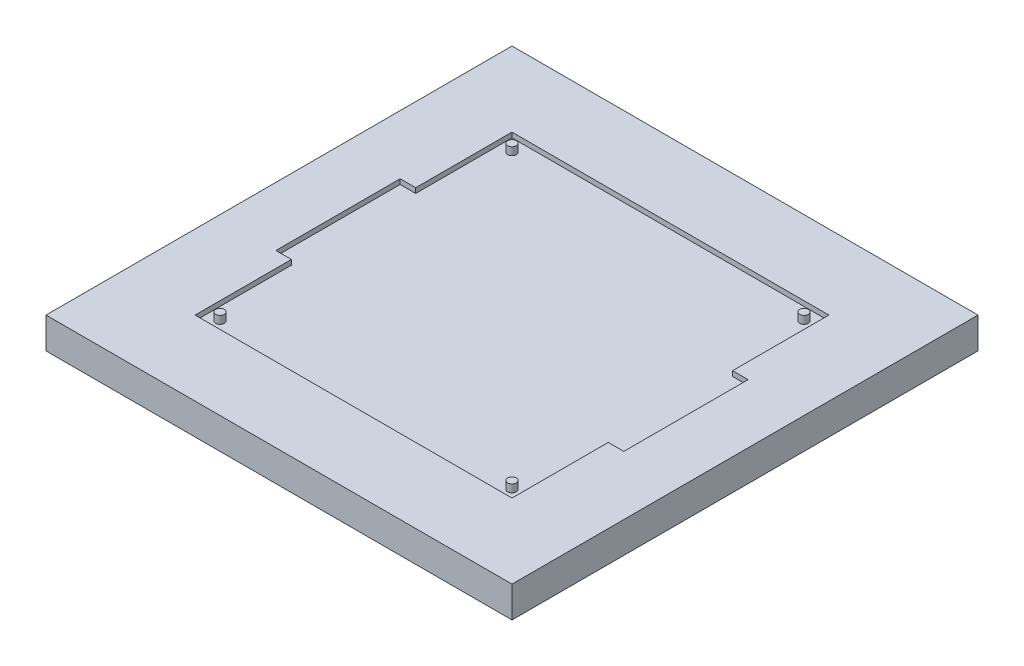
from build123d import *

# Parameters (mm, degrees)
SKETCH1_W           = 150
SKETCH1_H           = 150
BOSS_EXTRUDE1_DEPTH = 10
SKETCH3_W           = 102
SKETCH3_H           = 102
CUT_EXTRUDE1_DEPTH  = 1.6
SKETCH4_R           = 1.4
BOSS_EXTRUDE3_DEPTH = 2.5
SKETCH11_W          = 5
SKETCH11_H          = 40
CUT_EXTRUDE3_DEPTH  = 1.6


with BuildPart() as part:
    # Sketch1 → Boss-Extrude1 (new body)
    with BuildSketch(Plane(origin=(0, 0, 0), x_dir=(1, 0, 0), z_dir=(0, 1, 0))):
        with Locations((75, 75)):
            Rectangle(SKETCH1_W, SKETCH1_H)
    extrude(amount=BOSS_EXTRUDE1_DEPTH)

    # Sketch3 → Cut-Extrude1 (cut)
    with BuildSketch(Plane(origin=(0, 10, 0), x_dir=(1, 0, 0), z_dir=(0, 1, 0))):
        with Locations((75, 75)):
            Rectangle(SKETCH3_W, SKETCH3_H)
    extrude(amount=-CUT_EXTRUDE1_DEPTH, mode=Mode.SUBTRACT)

    # Sketch4 → Boss-Extrude3 (add)
    with BuildSketch(Plane(origin=(0, 8.4, 0), x_dir=(1, 0, 0), z_dir=(0, 1, 0))):
        with Locations((28, 122)):
            Circle(SKETCH4_R)
        with Locations((122, 122)):
            Circle(SKETCH4_R)
        with Locations((28, 28)):
            Circle(SKETCH4_R)
        with Locations((122, 28)):
            Circle(SKETCH4_R)
    extrude(amount=BOSS_EXTRUDE3_DEPTH)

    # Sketch11 → Cut-Extrude3 (cut)
    with BuildSketch(Plane(origin=(0, 10, 0), x_dir=(1, 0, 0), z_dir=(0, 1, 0))):
        with Locations((21.5, 75)):
            Rectangle(SKETCH11_W, SKETCH11_H)
        with Locations((128.5, 75)):
            Rectangle(SKETCH11_W, SKETCH11_H)
    extrude(amount=-CUT_EXTRUDE3_DEPTH, mode=Mode.SUBTRACT)


solid = part.part
